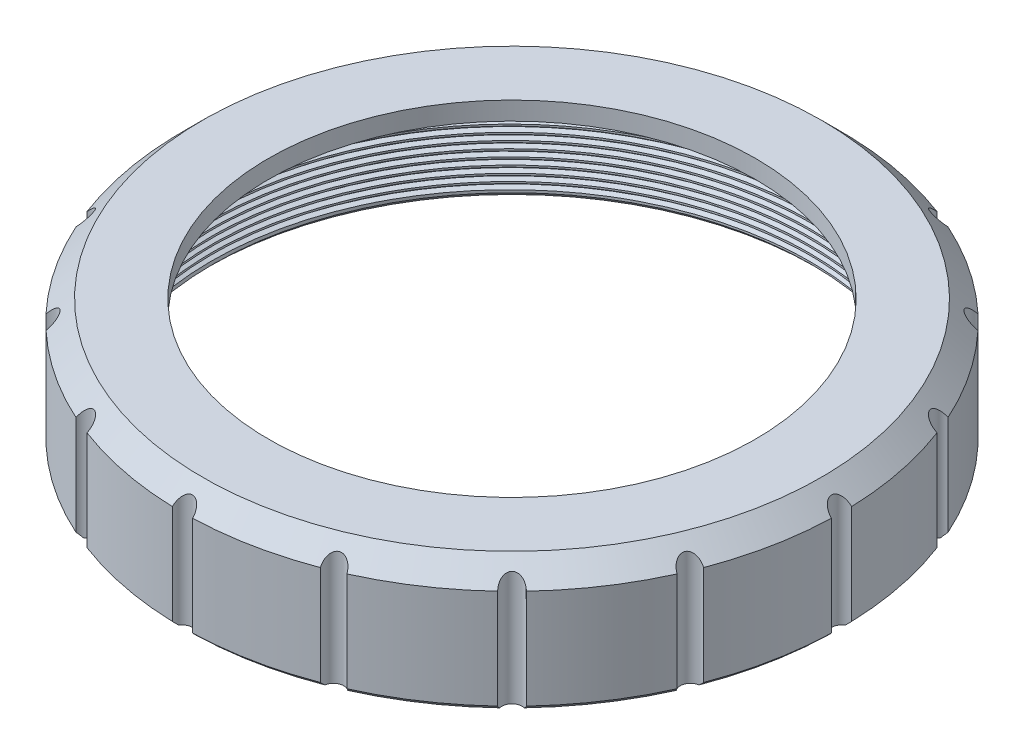
from build123d import *

# Parameters (mm, degrees)
CHAMFER1_SIZE      = 0.5
SKETCH2_R          = 1
CUT_EXTRUDE1_DEPTH = 48.545149595
CIRPATTERN1_COUNT  = 16
THREAD1_PITCH      = 0.7


with BuildPart() as part:
    # Sketch1 → Revolve1 (revolve)
    with BuildSketch(Plane.XY, mode=Mode.PRIVATE) as revolve1_sk:
        with BuildLine():
            Line((29.475, 0), (32.475, 0))
            Line((32.475, 0), (32.475, 10.3))
            Line((32.475, 10.3), (30.475, 12.3))
            Line((30.475, 12.3), (23.975, 12.3))
            Line((23.975, 12.3), (23.975, 10.5))
            Line((23.975, 10.5), (29.475, 10.5))
            ThreePointArc((29.475, 10.5), (30.440925826, 9.758819045), (29.975, 8.633974596))
            ThreePointArc((29.975, 8.633974596), (29.608974596, 8.267949192), (29.475, 7.767949192))
            Line((29.475, 7.767949192), (29.475, 0))
        make_face()
    revolve(revolve1_sk.sketch.rotate(Axis((0, 0, 0), (0, 1, 0)), 90), axis=Axis((0, 0, 0), (0, 1, 0)))

    # Chamfer1
    chamfer1_edges = [part.edges().sort_by_distance(p)[0] for p in [
        (0, 0, 29.475),
        (0, 0, 32.475),
    ]]
    chamfer(chamfer1_edges, length=CHAMFER1_SIZE)

    # Sketch2 → Cut-Extrude1 (cut, through all)
    with BuildSketch(Plane(origin=(0, 0, 0), x_dir=(1, 0, 0), z_dir=(0, 1, 0))):
        with Locations((0, 32.475)):
            Circle(SKETCH2_R)
    cut_extrude1 = extrude(amount=CUT_EXTRUDE1_DEPTH, mode=Mode.SUBTRACT)

    # CirPattern1: Cut-Extrude1 ×16 about axis
    cirpattern1_axis = Axis((0, 0, 0), (0, 1, 0))
    for i in range(1, CIRPATTERN1_COUNT):
        add(cut_extrude1.rotate(cirpattern1_axis, i * 360 / CIRPATTERN1_COUNT), mode=Mode.SUBTRACT)

    # Thread1: the profile of Thread Profile1 profile screwed along a right-hand helix of 10.382785 turns, 6 arcs to a turn; built about Z, then put on its axis
    thread1_z = Axis((0, 0, 0), (0, 0, 1))
    thread1_corners = [(29.4747, 0, -0.000173205), (29.853886113, 0, 0.218749999), (29.853886113, 0, 0.306249999), (29.4747, 0, 0.525173203)]
    with BuildLine(mode=Mode.PRIVATE) as thread1_profile:
        Line(thread1_corners[0], thread1_corners[1])
        Line(thread1_corners[1], thread1_corners[2])
        Line(thread1_corners[2], thread1_corners[3])
        Line(thread1_corners[3], thread1_corners[0])
    thread1_cap = Face(thread1_profile.wire())
    thread1_turn_angles = [0, 30, 60, 90, 120, 150, 180, 210, 240, 270, 300, 330, 360]
    thread1_turn_weights = [1, 0.8660254037844387, 1, 0.8660254037844387, 1, 0.8660254037844387, 1, 0.8660254037844387, 1, 0.8660254037844387, 1, 0.8660254037844387, 1]
    thread1_turn_rails = [Edge.make_bspline([Vector(p[0], p[1], 0).rotate(thread1_z, thread1_turn_angles[k]) / thread1_turn_weights[k] + Vector(0, 0, p[2] + THREAD1_PITCH * thread1_turn_angles[k] / 360) for k in range(13)], [0, 0, 0, 1, 1, 2, 2, 3, 3, 4, 4, 5, 5, 6, 6, 6], 2, thread1_turn_weights) for p in thread1_corners]
    thread1_turn_sides = [Face.make_surface_from_curves(thread1_turn_rails[p[0]], thread1_turn_rails[p[1]]) for p in [(0, 1), (1, 2), (2, 3), (3, 0)]]
    thread1_last_angles = [3600, 3630, 3660, 3690, 3720, 3728.901220911, 3737.802441822]
    thread1_last_weights = [1, 0.8660254037844387, 1, 0.8660254037844387, 1, 0.9879565688347118, 1]
    thread1_last_rails = [Edge.make_bspline([Vector(p[0], p[1], 0).rotate(thread1_z, thread1_last_angles[k]) / thread1_last_weights[k] + Vector(0, 0, p[2] + THREAD1_PITCH * thread1_last_angles[k] / 360) for k in range(7)], [0, 0, 0, 1, 1, 2, 2, 3, 3, 3], 2, thread1_last_weights) for p in thread1_corners]
    thread1_last_sides = [Face.make_surface_from_curves(thread1_last_rails[p[0]], thread1_last_rails[p[1]]) for p in [(0, 1), (1, 2), (2, 3), (3, 0)]]
    thread1 = Plane(origin=(0, 0.5, 0), x_dir=(1, 0, 0), z_dir=(0, 1, 0)) * Solid(Shell([*[p.moved(Location((0, 0, THREAD1_PITCH * i))) for i in range(10) for p in thread1_turn_sides], *thread1_last_sides, thread1_cap, thread1_cap.rotate(thread1_z, 3737.802441822).moved(Location((0, 0, THREAD1_PITCH * 3737.802441822 / 360)))]))
    add(thread1, mode=Mode.SUBTRACT)


solid = part.part
